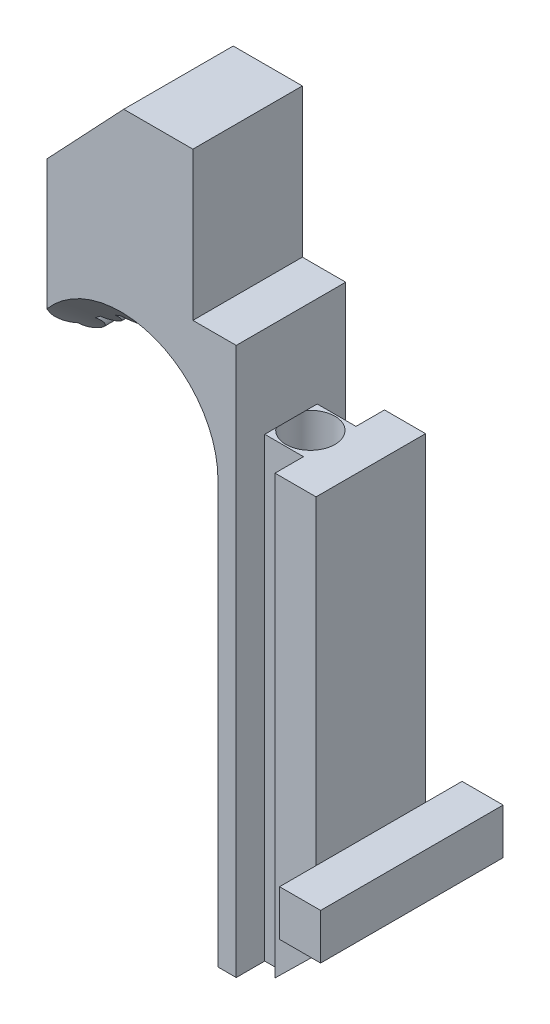
from build123d import *

# Parameters (mm, degrees)
BOSS_EXTRU_1_DEPTH      = 40
ESQUISSE2_R             = 2.15
ENL_V_MAT_EXTRU_1_DEPTH = 10
BOSS_EXTRU_2_START      = -8
BOSS_EXTRU_2_DEPTH      = 4
ENL_V_MAT_EXTRU_2_DEPTH = 43.930758204
BOSS_EXTRU_3_DEPTH      = 9.6
ENL_V_MAT_EXTRU_3_DEPTH = 65.959448889
CONG_1_R                = 1
BOSS_EXTRU_4_DEPTH      = 9.6
CHANFREIN1_2_DEPTH      = 37


with BuildPart() as part:
    # Esquisse1 → Boss.-Extru.1 (new body)
    with BuildSketch(Plane(origin=(0, 0, 0), x_dir=(1, 0, 0), z_dir=(0, 1, 0))):
        Polygon((-5.3, -4.8), (-5.3, 4.8), (-1.7, 4.8), (-1.7, 2.3), (1.7, 2.3), (1.7, 4.8), (5.3, 4.8), (5.3, -4.8), (1.7, -4.8), (1.7, -2.3), (-1.7, -2.3), (-1.7, -4.8), align=None)
    extrude(amount=BOSS_EXTRU_1_DEPTH)

    # Esquisse2 → Enlèv. mat.-Extru.1 (cut)
    with BuildSketch(Plane(origin=(0, 40, 0), x_dir=(1, 0, 0), z_dir=(0, 1, 0))):
        with Locations(Location((0, 0, 0), (0, 0, 270))):
            Circle(ESQUISSE2_R)
    extrude(amount=-ENL_V_MAT_EXTRU_1_DEPTH, mode=Mode.SUBTRACT)

    # Esquisse3 → Boss.-Extru.2 (add)
    with BuildSketch(Plane.XZ.offset(BOSS_EXTRU_2_START)):
        Polygon((8.9, 1.238996105), (8.9, 8), (5.3, 8), (5.3, 0), (5.3, -8), (8.9, -8), align=None)
    extrude(amount=-BOSS_EXTRU_2_DEPTH)

    # Esquisse4 → Enlèv. mat.-Extru.2 (cut, through all)
    with BuildSketch(Plane.XY.offset(4.8)):
        Polygon((0, 0), (5.3, 5.2), (5.3, 0), align=None)
    extrude(amount=-ENL_V_MAT_EXTRU_2_DEPTH, mode=Mode.SUBTRACT)

    # Esquisse5 → Boss.-Extru.3 (add)
    with BuildSketch(Plane.XY.offset(4.8)):
        Polygon((-5.3, 40), (-1.7, 40), (-1.7, 48), (-5.5, 48), (-5.5, 61), (-11.562520068, 61), (-18.3, 53.86), (-18.3, 37), (-5.3, 37), align=None)
    extrude(amount=-BOSS_EXTRU_3_DEPTH)

    # Esquisse6 → Enlèv. mat.-Extru.3 (cut, through all)
    with BuildSketch(Plane.XY.offset(4.8)):
        with BuildLine():
            Line((-18.3, 37), (-5.3, 37))
            ThreePointArc((-5.3, 37), (-11.8, 43.5), (-18.3, 37))
        make_face()
    extrude(amount=-ENL_V_MAT_EXTRU_3_DEPTH, mode=Mode.SUBTRACT)

    # Congé1
    # the kernel refuses this fillet: 1 mm, written as the material it takes off along each edge
    with BuildSketch(Plane(origin=(-18.3, 37, 17.547548784), x_dir=(0.3651483716701853, 0.9309493362512336, 0), z_dir=(0, 0, -1))) as cong_1_piece_1:
        with BuildLine():
            CenterArc((5.112077203, -0.930949336), CONG_1_R, 111.416714033, 137.166571934)
            Line((4.746928832, -1.861898673), (0, 0))
            ThreePointArc((0, 0), (2.373464416, -0.448829314), (4.746928832, 0))
        make_face()
    extrude(amount=35.095097568, mode=Mode.SUBTRACT)

    # Esquisse7 → Boss.-Extru.4 (add)
    with BuildSketch(Plane.XY.offset(4.8)):
        with BuildLine():
            ThreePointArc((-14.307835067, 42.996729381), (-15.349063211, 43.321918247), (-15.613639592, 42.263663464))
            ThreePointArc((-15.613639592, 42.263663464), (-14.981918741, 42.667926704), (-14.307835067, 42.996729381))
        make_face()
        with BuildLine():
            ThreePointArc((-14.307835067, 42.996729381), (-14.981918741, 42.667926704), (-15.613639592, 42.263663464))
            ThreePointArc((-15.613639592, 42.263663464), (-14.771313231, 41.948103588), (-14.231918741, 42.667926704))
            ThreePointArc((-14.231918741, 42.667926704), (-14.251144236, 42.836653176), (-14.307835067, 42.996729381))
        make_face()
        with BuildLine():
            ThreePointArc((-17.245608427, 41.100499831), (-16.403428068, 40.687130327), (-15.816666667, 41.419150245))
            ThreePointArc((-15.816666667, 41.419150245), (-15.870934112, 41.699250606), (-16.025883233, 41.938816751))
            ThreePointArc((-16.025883233, 41.938816751), (-16.303776387, 41.68678976), (-16.566666667, 41.419150245))
            ThreePointArc((-16.566666667, 41.419150245), (-16.875132781, 41.193763834), (-17.245608427, 41.100499831))
        make_face()
        with BuildLine():
            ThreePointArc((-16.566666667, 41.419150245), (-16.303776387, 41.68678976), (-16.025883233, 41.938816751))
            ThreePointArc((-16.025883233, 41.938816751), (-16.991479267, 42.037239441), (-17.245608427, 41.100499831))
            ThreePointArc((-17.245608427, 41.100499831), (-16.875132781, 41.193763834), (-16.566666667, 41.419150245))
        make_face()
        with BuildLine():
            ThreePointArc((-12.348152178, 43.47684562), (-13.239500701, 44.105655335), (-13.815839123, 43.179513948))
            ThreePointArc((-13.815839123, 43.179513948), (-13.090586835, 43.370587541), (-12.348152178, 43.47684562))
        make_face()
        with BuildLine():
            ThreePointArc((-12.348152178, 43.47684562), (-13.090586835, 43.370587541), (-13.815839123, 43.179513948))
            ThreePointArc((-13.815839123, 43.179513948), (-12.994252045, 42.626800201), (-12.340586835, 43.370587541))
            ThreePointArc((-12.340586835, 43.370587541), (-12.342480561, 43.42385107), (-12.348152178, 43.47684562))
        make_face()
        with BuildLine():
            ThreePointArc((-10.324904409, 43.459430036), (-11.054633824, 44.209156054), (-11.823808685, 43.499956396))
            ThreePointArc((-11.823808685, 43.499956396), (-11.074904409, 43.459430036), (-10.335653773, 43.332905346))
            ThreePointArc((-10.335653773, 43.332905346), (-10.327596582, 43.395939789), (-10.324904409, 43.459430036))
        make_face()
        with BuildLine():
            ThreePointArc((-10.335653773, 43.332905346), (-11.074904409, 43.459430036), (-11.823808685, 43.499956396))
            ThreePointArc((-11.823808685, 43.499956396), (-11.158569285, 42.714111185), (-10.335653773, 43.332905346))
        make_face()
        with BuildLine():
            ThreePointArc((-8.379086335, 42.925894042), (-8.992701628, 43.66338927), (-9.829484233, 43.194115563))
            ThreePointArc((-9.829484233, 43.194115563), (-9.129086335, 42.925894042), (-8.464247939, 42.578777481))
            ThreePointArc((-8.464247939, 42.578777481), (-8.400687819, 42.747188694), (-8.379086335, 42.925894042))
        make_face()
        with BuildLine():
            ThreePointArc((-8.464247939, 42.578777481), (-9.129086335, 42.925894042), (-9.829484233, 43.194115563))
            ThreePointArc((-9.829484233, 43.194115563), (-9.437268681, 42.242137037), (-8.464247939, 42.578777481))
        make_face()
        with BuildLine():
            ThreePointArc((-6.690615922, 41.821386778), (-7.191422351, 42.528778158), (-8.02502276, 42.291459802))
            ThreePointArc((-8.02502276, 42.291459802), (-7.440615922, 41.821386778), (-6.914248222, 41.287123693))
            ThreePointArc((-6.914248222, 41.287123693), (-6.748779318, 41.53179722), (-6.690615922, 41.821386778))
        make_face()
        with BuildLine():
            ThreePointArc((-6.914248222, 41.287123693), (-7.440615922, 41.821386778), (-8.02502276, 42.291459802))
            ThreePointArc((-8.02502276, 42.291459802), (-7.943621777, 41.265072919), (-6.914248222, 41.287123693))
        make_face()
        with BuildLine():
            ThreePointArc((-5.422180536, 40.25232964), (-5.81621726, 40.912473674), (-6.584287593, 40.878961728))
            ThreePointArc((-6.584287593, 40.878961728), (-6.172180536, 40.25232964), (-5.83500007, 39.582397305))
            ThreePointArc((-5.83500007, 39.582397305), (-5.533672373, 39.858874019), (-5.422180536, 40.25232964))
        make_face()
        with BuildLine():
            ThreePointArc((-5.83500007, 39.582397305), (-6.172180536, 40.25232964), (-6.584287593, 40.878961728))
            ThreePointArc((-6.584287593, 40.878961728), (-6.821544321, 39.877060835), (-5.83500007, 39.582397305))
        make_face()
        with BuildLine():
            ThreePointArc((-4.695996363, 38.369904295), (-4.991890085, 38.966802518), (-5.646096332, 39.092718242))
            ThreePointArc((-5.646096332, 39.092718242), (-5.445996363, 38.369904295), (-5.330491117, 37.628851977))
            ThreePointArc((-5.330491117, 37.628851977), (-4.876290766, 37.882117935), (-4.695996363, 38.369904295))
        make_face()
        with BuildLine():
            ThreePointArc((-5.330491117, 37.628851977), (-5.445996363, 38.369904295), (-5.646096332, 39.092718242))
            ThreePointArc((-5.646096332, 39.092718242), (-6.179150629, 38.211838415), (-5.330491117, 37.628851977))
        make_face()
    extrude(amount=-BOSS_EXTRU_4_DEPTH)

    # Chanfrein1: read off the stored shape, not the designer's step
    # Chanfrein1 outline → Chanfrein1 (revolve, cut)
    with BuildSketch(Plane(origin=(-11.8, 37, 0), x_dir=(1, 0, 0), z_dir=(0, -1, 0))):
        Polygon((8.5, -4.8), (5.749750624, -2.049750624), (5.749750624, -4.8), align=None)
        Polygon((5.749750624, 4.8), (5.749750624, 2.049750624), (8.5, 4.8), align=None)
    revolve(axis=Axis((-11.8, 37, 0), (0, 0, 1)), mode=Mode.SUBTRACT)

    # Chanfrein1 2 outline → Chanfrein1 2 (cut)
    with BuildSketch(Plane(origin=(0, 0, 0), x_dir=(1, 0, 0), z_dir=(0, 1, 0))):
        Polygon((-5.3, 4.8), (-5.3, 2.8), (-3.3, 4.8), align=None)
        Polygon((-3.3, -4.8), (-5.3, -2.8), (-5.3, -4.8), align=None)
    extrude(amount=CHANFREIN1_2_DEPTH, mode=Mode.SUBTRACT)


solid = part.part
